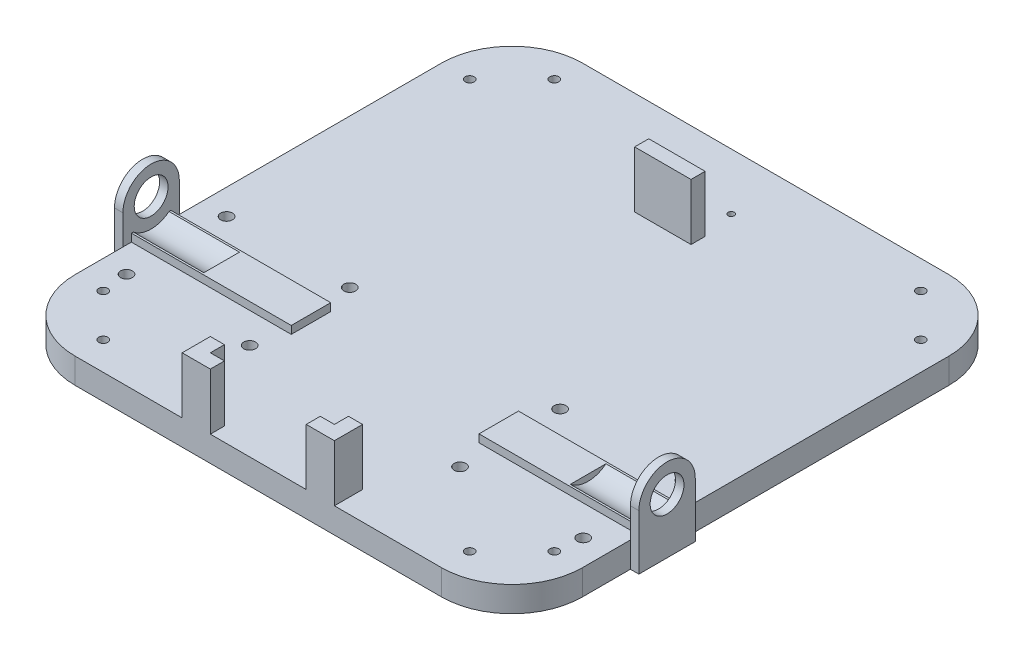
from build123d import *

# Parameters (mm, degrees)
PLATE_DEPTH          = 9
SKETCH2_R            = 1.095
CASTER_HOLES_DEPTH   = 128.597021909
SKETCH3_R            = 1.6
HEX_HOLES_DEPTH      = 128.597021909
SKETCH4_W            = 20
SKETCH4_H            = 5
BATTERY_HOLDER_DEPTH = 20
SKETCH5_W            = 56.7
SKETCH5_H            = 14
BOSS_EXTRUDE2_DEPTH  = 2.75
SKETCH6_R            = 10
CUT_EXTRUDE1_DEPTH   = 25
CUT_EXTRUDE2_START   = -25
SKETCH7_R            = 10
CUT_EXTRUDE2_DEPTH   = 25
SKETCH8_R            = 6
BOSS_EXTRUDE4_DEPTH  = 3
BOSS_EXTRUDE5_START  = 3
SKETCH9_R            = 6
BOSS_EXTRUDE5_DEPTH  = 3
SKETCH10_R           = 2.1
CLAMP_HOLES_DEPTH    = 132.031484766


with BuildPart() as part:
    # Sketch1 → Plate (new body)
    with BuildSketch(Plane(origin=(0, 0, 0), x_dir=(1, 0, 0), z_dir=(0, 1, 0))):
        with BuildLine():
            Line((-65, -90), (65, -90))
            ThreePointArc((65, -90), (82.67766953, -82.67766953), (90, -65))
            Line((90, -65), (90, 65))
            ThreePointArc((90, 65), (82.67766953, 82.67766953), (65, 90))
            Line((65, 90), (-65, 90))
            ThreePointArc((-65, 90), (-82.67766953, 82.67766953), (-90, 65))
            Line((-90, 65), (-90, -65))
            ThreePointArc((-90, -65), (-82.67766953, -82.67766953), (-65, -90))
        make_face()
    extrude(amount=PLATE_DEPTH)

    # Sketch2 → Caster Holes (cut, through all)
    with BuildSketch(Plane(origin=(0, 9, 0), x_dir=(1, 0, 0), z_dir=(0, 1, 0))):
        with Locations((-7.747, 70)):
            Circle(SKETCH2_R)
        with Locations((7.747, 70)):
            Circle(SKETCH2_R)
    extrude(amount=-CASTER_HOLES_DEPTH, mode=Mode.SUBTRACT)

    # Sketch3 → Hex Holes (cut, through all)
    with BuildSketch(Plane(origin=(0, 9, 0), x_dir=(1, 0, 0), z_dir=(0, 1, 0))):
        with Locations((-65, 80)):
            Circle(SKETCH3_R)
        with Locations((-80, 65)):
            Circle(SKETCH3_R)
        with Locations((80, 65)):
            Circle(SKETCH3_R)
        with Locations((80, -65)):
            Circle(SKETCH3_R)
        with Locations((65, 80)):
            Circle(SKETCH3_R)
        with Locations((65, -80)):
            Circle(SKETCH3_R)
        with Locations((-65, -80)):
            Circle(SKETCH3_R)
        with Locations((-80, -65)):
            Circle(SKETCH3_R)
    extrude(amount=-HEX_HOLES_DEPTH, mode=Mode.SUBTRACT)

    # Sketch4 → Battery Holder (add)
    with BuildSketch(Plane(origin=(0, 9, 0), x_dir=(1, 0, 0), z_dir=(0, 1, 0))):
        Polygon((-27, -90), (-27, -80), (-22, -80), (-22, -85), (-17, -85), (-17, -90), align=None)
        Polygon((17, -90), (17, -85), (22, -85), (22, -80), (27, -80), (27, -90), align=None)
        with Locations((0, 56)):
            Rectangle(SKETCH4_W, SKETCH4_H)
    extrude(amount=BATTERY_HOLDER_DEPTH)

    # Sketch5 → Boss-Extrude2 (add)
    with BuildSketch(Plane(origin=(0, 9, 0), x_dir=(1, 0, 0), z_dir=(0, 1, 0))):
        with Locations((-61.65, -38)):
            Rectangle(SKETCH5_W, SKETCH5_H)
        with Locations((61.65, -38)):
            Rectangle(SKETCH5_W, SKETCH5_H)
    extrude(amount=BOSS_EXTRUDE2_DEPTH)

    # Sketch6 → Cut-Extrude1 (cut)
    with BuildSketch(Plane.ZY.offset(90)):
        with Locations((38, 19.5)):
            Circle(SKETCH6_R)
    extrude(amount=-CUT_EXTRUDE1_DEPTH, mode=Mode.SUBTRACT)

    # Sketch7 → Cut-Extrude2 (cut)
    with BuildSketch(Plane(origin=(90, 0, 0), x_dir=(0, 0, -1), z_dir=(1, 0, 0)).offset(CUT_EXTRUDE2_START)):
        with Locations((-38, 19.5)):
            Circle(SKETCH7_R)
    extrude(amount=CUT_EXTRUDE2_DEPTH, mode=Mode.SUBTRACT)

    # Sketch8 → Boss-Extrude4 (add)
    with BuildSketch(Plane(origin=(90, 0, 0), x_dir=(0, 0, -1), z_dir=(1, 0, 0))):
        with BuildLine():
            Line((-48, 19.5), (-48, 0))
            Line((-48, 0), (-28, 0))
            Line((-28, 0), (-28, 19.5))
            ThreePointArc((-28, 19.5), (-38, 29.5), (-48, 19.5))
        make_face()
        with Locations((-38, 19.5)):
            Circle(SKETCH8_R, mode=Mode.SUBTRACT)
    extrude(amount=BOSS_EXTRUDE4_DEPTH)

    # Sketch9 → Boss-Extrude5 (add)
    with BuildSketch(Plane.ZY.offset(90).offset(BOSS_EXTRUDE5_START)):
        with BuildLine():
            Line((28, 19.5), (28, 0))
            Line((28, 0), (48, 0))
            Line((48, 0), (48, 19.5))
            ThreePointArc((48, 19.5), (38, 29.5), (28, 19.5))
        make_face()
        with Locations((38, 19.5)):
            Circle(SKETCH9_R, mode=Mode.SUBTRACT)
    extrude(amount=-BOSS_EXTRUDE5_DEPTH)

    # Sketch10 → Clamp Holes (cut, through all)
    with BuildSketch(Plane(origin=(0, 9, 0), x_dir=(1, 0, 0), z_dir=(0, 1, 0))):
        with Locations((81, -55.75)):
            Circle(SKETCH10_R)
        with Locations((81, -20.25)):
            Circle(SKETCH10_R)
        with Locations((-81, -20.25)):
            Circle(SKETCH10_R)
        with Locations((-81, -55.75)):
            Circle(SKETCH10_R)
        with Locations((-37.3, -20.25)):
            Circle(SKETCH10_R)
        with Locations((-37.3, -55.75)):
            Circle(SKETCH10_R)
        with Locations((37.3, -55.75)):
            Circle(SKETCH10_R)
        with Locations((37.3, -20.25)):
            Circle(SKETCH10_R)
    extrude(amount=-CLAMP_HOLES_DEPTH, mode=Mode.SUBTRACT)


solid = part.part
